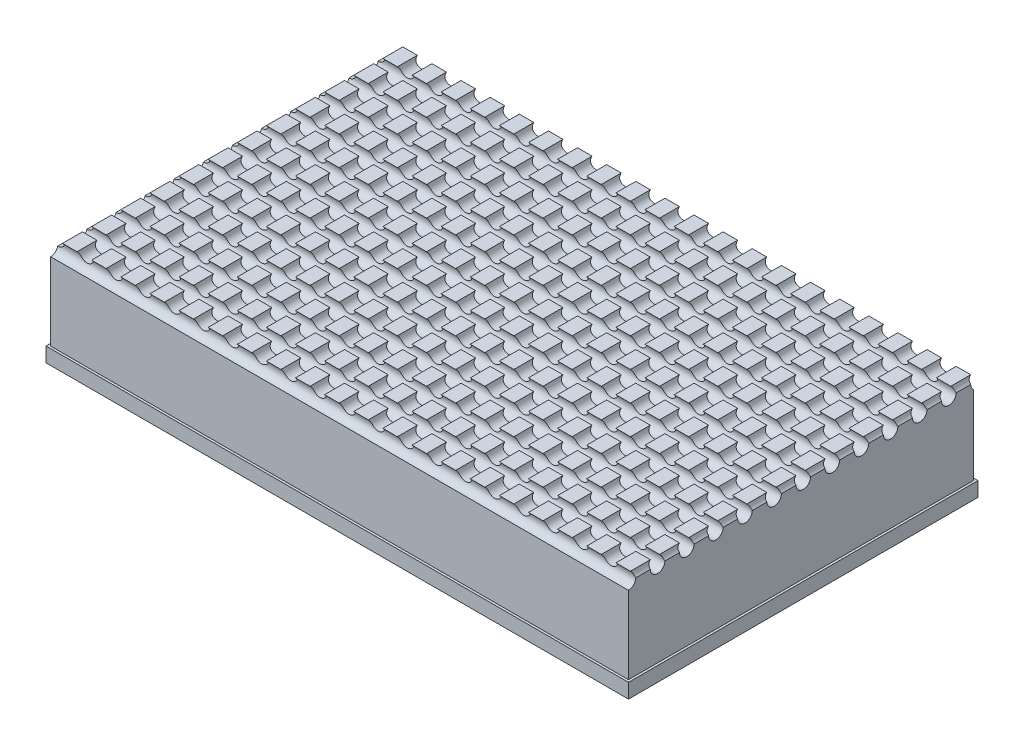
from build123d import *

# Parameters (mm, degrees)
SKETCH1_W           = 127
SKETCH1_H           = 76.2
BOSS_EXTRUDE1_DEPTH = 3.175
SKETCH3_W           = 126
SKETCH3_H           = 75.2
BOSS_EXTRUDE4_DEPTH = 19.685
SKETCH4_R           = 1.5875
CUT_EXTRUDE1_DEPTH  = 150.606382217
SKETCH5_R           = 1.5875
CUT_EXTRUDE2_DEPTH  = 150.436506918


with BuildPart() as part:
    # Sketch1 → Boss-Extrude1 (new body)
    with BuildSketch(Plane(origin=(0, 0, 0), x_dir=(1, 0, 0), z_dir=(0, 1, 0))):
        with Locations((-63.5, 38.1)):
            Rectangle(SKETCH1_W, SKETCH1_H)
    extrude(amount=BOSS_EXTRUDE1_DEPTH)

    # Sketch3 → Boss-Extrude4 (add)
    with BuildSketch(Plane(origin=(0, 3.175, 0), x_dir=(1, 0, 0), z_dir=(0, 1, 0))):
        with Locations((-63.5, 38.1)):
            Rectangle(SKETCH3_W, SKETCH3_H)
    extrude(amount=BOSS_EXTRUDE4_DEPTH)

    # Sketch4 → Cut-Extrude1 (cut, through all)
    with BuildSketch(Plane.XY.offset(-0.5)):
        with Locations((-126.5, 22.86)):
            Circle(SKETCH4_R)
        with Locations((-120.15, 22.86)):
            Circle(SKETCH4_R)
        with Locations((-113.8, 22.86)):
            Circle(SKETCH4_R)
        with Locations((-107.45, 22.86)):
            Circle(SKETCH4_R)
        with Locations((-101.1, 22.86)):
            Circle(SKETCH4_R)
        with Locations((-94.75, 22.86)):
            Circle(SKETCH4_R)
        with Locations((-88.4, 22.86)):
            Circle(SKETCH4_R)
        with Locations((-82.05, 22.86)):
            Circle(SKETCH4_R)
        with Locations((-75.7, 22.86)):
            Circle(SKETCH4_R)
        with Locations((-69.35, 22.86)):
            Circle(SKETCH4_R)
        with Locations((-63, 22.86)):
            Circle(SKETCH4_R)
        with Locations((-56.65, 22.86)):
            Circle(SKETCH4_R)
        with Locations((-50.3, 22.86)):
            Circle(SKETCH4_R)
        with Locations((-43.95, 22.86)):
            Circle(SKETCH4_R)
        with Locations((-37.6, 22.86)):
            Circle(SKETCH4_R)
        with Locations((-31.25, 22.86)):
            Circle(SKETCH4_R)
        with Locations((-24.9, 22.86)):
            Circle(SKETCH4_R)
        with Locations((-18.55, 22.86)):
            Circle(SKETCH4_R)
        with Locations((-12.2, 22.86)):
            Circle(SKETCH4_R)
        with Locations((-5.85, 22.86)):
            Circle(SKETCH4_R)
        with Locations((0.5, 22.86)):
            Circle(SKETCH4_R)
    extrude(amount=-CUT_EXTRUDE1_DEPTH, mode=Mode.SUBTRACT)

    # Sketch5 → Cut-Extrude2 (cut, through all)
    with BuildSketch(Plane(origin=(-0.5, 0, 0), x_dir=(0, 0, -1), z_dir=(1, 0, 0))):
        with Locations((0.5, 21.627053833)):
            Circle(SKETCH5_R)
        with Locations((6.85, 21.627053833)):
            Circle(SKETCH5_R)
        with Locations((13.2, 21.627053833)):
            Circle(SKETCH5_R)
        with Locations((19.55, 21.627053833)):
            Circle(SKETCH5_R)
        with Locations((25.9, 21.627053833)):
            Circle(SKETCH5_R)
        with Locations((32.25, 21.627053833)):
            Circle(SKETCH5_R)
        with Locations((38.6, 21.627053833)):
            Circle(SKETCH5_R)
        with Locations((44.95, 21.627053833)):
            Circle(SKETCH5_R)
        with Locations((51.3, 21.627053833)):
            Circle(SKETCH5_R)
        with Locations((57.65, 21.627053833)):
            Circle(SKETCH5_R)
        with Locations((64, 21.627053833)):
            Circle(SKETCH5_R)
        with Locations((70.35, 21.627053833)):
            Circle(SKETCH5_R)
        with Locations((76.7, 21.627053833)):
            Circle(SKETCH5_R)
    extrude(amount=-CUT_EXTRUDE2_DEPTH, mode=Mode.SUBTRACT)


solid = part.part
